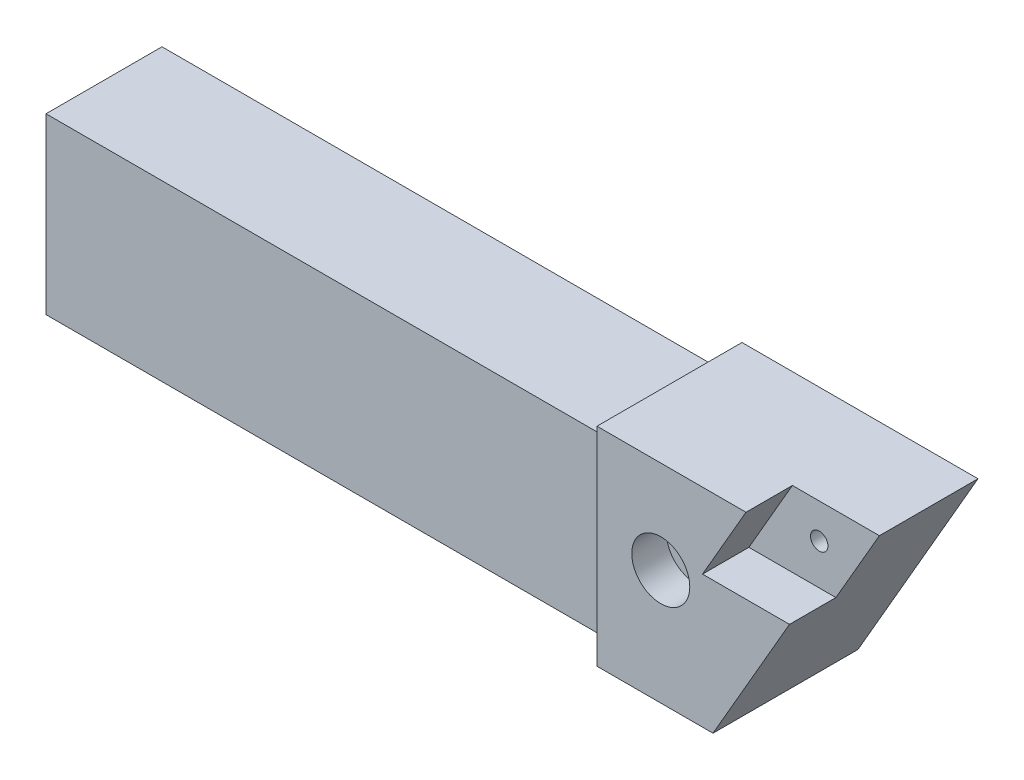
from build123d import *

# Parameters (mm, degrees)
SKETCH_1_W                = 100
SKETCH_1_H                = 30
EXTRUDE_1_DEPTH           = 20
EXTRUDE_2_DEPTH           = 5
EXTRUDE_2_DEPTH_BACK      = 20
FILLET_1_R                = 5
CUT_EXTRUDE_1_DEPTH       = 8
SKETCH_4_R                = 1.5
CUT_EXTRUDE_2_DEPTH       = 95.599814737
HOLE_WIZARD_1_D           = 5
HOLE_WIZARD_1_CBORE_D     = 10
HOLE_WIZARD_1_CBORE_DEPTH = 6


with BuildPart() as part:
    # 草图1 → 凸台-拉伸1 (new body)
    with BuildSketch(Plane.XY):
        Rectangle(SKETCH_1_W, SKETCH_1_H)
    extrude(amount=EXTRUDE_1_DEPTH)

    # 草图2 → 凸台-拉伸2 (add, two sides: drawn at the far end of the back side and taken through both)
    with BuildSketch(Plane.XY.offset(20).offset(-EXTRUDE_2_DEPTH_BACK)):
        Polygon((50, -15), (70, -15), (90.695144291, 20.845041382), (50, 20.845041382), align=None)
    extrude(amount=EXTRUDE_2_DEPTH + EXTRUDE_2_DEPTH_BACK)

    # 圆角1
    fillet_1_edges = [part.edges().sort_by_distance(p)[0] for p in [
        (50, 15, 10),
        (50, 0, 20),
    ]]
    fillet(fillet_1_edges, radius=FILLET_1_R - 0.0001)  # a hair under: the kernel refuses the full size

    # 草图3 → 切除-拉伸1 (cut)
    with BuildSketch(Plane.XY.offset(25)):
        Polygon((75.695144291, 20.845041382), (68.195144291, 7.854660326), (83.195144291, 7.854660326), (90.695144291, 20.845041382), align=None)
    extrude(amount=-CUT_EXTRUDE_1_DEPTH, mode=Mode.SUBTRACT)

    # 草图4 → 切除-拉伸2 (cut, through all)
    with BuildSketch(Plane.XY.offset(17)):
        with Locations((80.319499944, 14.854660326)):
            Circle(SKETCH_4_R)
    extrude(amount=-CUT_EXTRUDE_2_DEPTH, mode=Mode.SUBTRACT)

    # 孔1 (through all)
    with Locations(Plane(origin=(61, 4.845041382, 25), x_dir=(1, 0, 0), z_dir=(0, 0, 1))):
        with Locations((0, 0)):
            CounterBoreHole(HOLE_WIZARD_1_D / 2, HOLE_WIZARD_1_CBORE_D / 2, HOLE_WIZARD_1_CBORE_DEPTH)


solid = part.part
